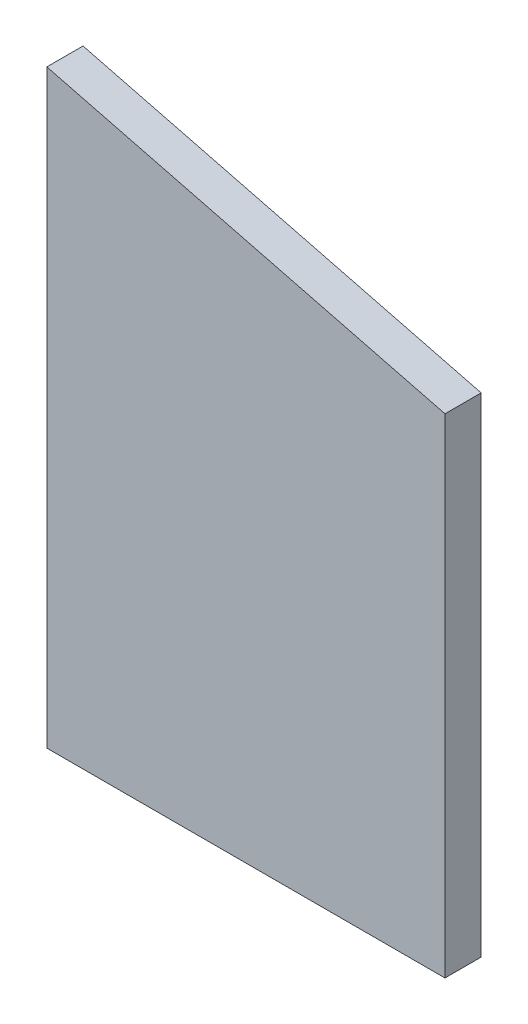
from build123d import *

# Parameters (mm, degrees)
BOSS_EXTRU_1_DEPTH = 10


with BuildPart() as part:
    # Esquisse1 → Boss.-Extru.1 (new body)
    with BuildSketch(Plane.XY):
        Polygon((10, 173), (120, 145), (120, 10), (10, 10), align=None)
    extrude(amount=-BOSS_EXTRU_1_DEPTH)


solid = part.part
